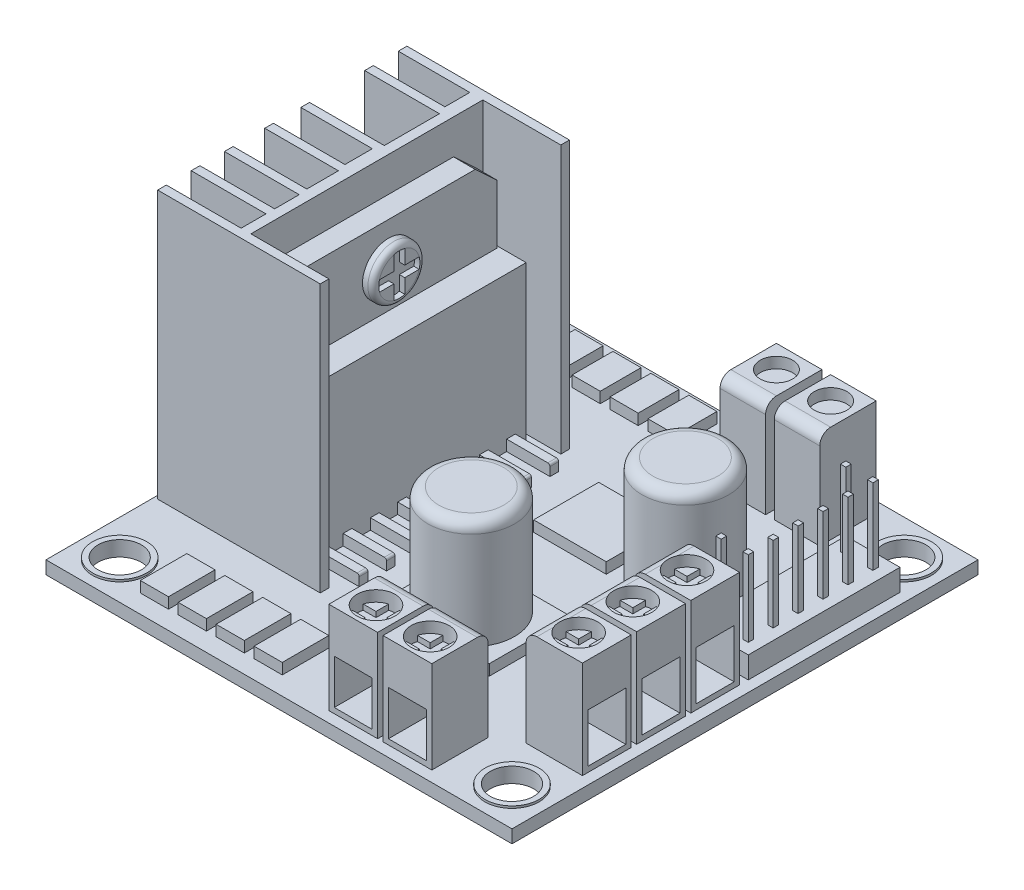
from build123d import *

# Parameters (mm, degrees)
CROQUIS2_W               = 43
CROQUIS2_H               = 43
SALIENTE_EXTRUIR1_DEPTH  = 1.2
CROQUIS3_W               = 15
CROQUIS3_H               = 23
SALIENTE_EXTRUIR2_DEPTH  = 24.7
CROQUIS4_W               = 6.4
CROQUIS4_H               = 21.4
CROQUIS4_W_2             = 0.8
CORTAR_EXTRUIR2_DEPTH    = 24.7
CROQUIS6_W               = 6.9
CROQUIS6_H               = 2.29421504
CROQUIS6_H_2             = 2.267309512
CROQUIS6_W_2             = 6.8
CROQUIS6_H_3             = 2.917748243
CROQUIS6_W_3             = 6.6
CROQUIS6_H_4             = 2.531488686
CROQUIS6_H_5             = 5.090458255
CROQUIS6_H_6             = 2.298780264
CORTAR_EXTRUIR4_DEPTH    = 24.7
SALIENTE_EXTRUIR3_DEPTH  = 2
CROQUIS8_R               = 2.4
SALIENTE_EXTRUIR4_DEPTH  = 1
REDONDEO1_R              = 0.5
CORTAR_EXTRUIR5_DEPTH    = 0.5
CROQUIS10_W              = 20.4
CROQUIS10_H              = 14.2
SALIENTE_EXTRUIR5_DEPTH  = 4.5
CROQUIS11_W              = 0.8
CROQUIS11_H              = 1
SALIENTE_EXTRUIR6_DEPTH  = 4
REDONDEO3_R              = 0.2
SALIENTE_EXTRUIR8_DEPTH  = 1
CROQUIS14_R              = 4
SALIENTE_EXTRUIR9_DEPTH  = 10
REDONDEO4_R              = 1
CROQUIS15_R              = 2.5
CROQUIS15_R_2            = 2
SALIENTE_EXTRUIR10_DEPTH = 0.2
CROQUIS16_R              = 2
CORTAR_EXTRUIR6_DEPTH    = 66.636041928
CROQUIS17_W              = 6.7
CROQUIS17_H              = 6
SALIENTE_EXTRUIR11_DEPTH = 1
CROQUIS18_W              = 2.6
CROQUIS18_H              = 4.3
SALIENTE_EXTRUIR12_DEPTH = 1
CROQUIS19_W              = 4.5
CROQUIS19_H              = 5.2
SALIENTE_EXTRUIR13_DEPTH = 8.5
REDONDEO5_R              = 1
CROQUIS20_W              = 3.5
CROQUIS20_H              = 4.1
CORTAR_EXTRUIR7_DEPTH    = 4.2
CROQUIS21_R              = 1.75
CORTAR_EXTRUIR8_DEPTH    = 1
CORTAR_EXTRUIR9_DEPTH    = 0.5
CROQUIS23_R              = 4
SALIENTE_EXTRUIR14_DEPTH = 10
REDONDEO6_R              = 1
CROQUIS24_W              = 5.2
CROQUIS24_H              = 4.5
SALIENTE_EXTRUIR15_DEPTH = 9
CROQUIS25_W              = 3.5
CROQUIS25_H              = 4.5
CORTAR_EXTRUIR10_DEPTH   = 4.2
CROQUIS26_R              = 1.75
CORTAR_EXTRUIR11_DEPTH   = 1
CORTAR_EXTRUIR12_DEPTH   = 0.5
CROQUIS28_W              = 5
CROQUIS28_H              = 14
SALIENTE_EXTRUIR16_DEPTH = 2
CROQUIS29_W              = 0.5
CROQUIS29_H              = 0.5
SALIENTE_EXTRUIR17_DEPTH = 7
CROQUIS30_W              = 0.5
CROQUIS30_H              = 0.5
SALIENTE_EXTRUIR18_DEPTH = 7
CROQUIS31_W              = 4.2
CROQUIS31_H              = 5.2
SALIENTE_EXTRUIR19_DEPTH = 9
REDONDEO7_R              = 1
REDONDEO8_R              = 1
CROQUIS32_W              = 3.2
CROQUIS32_H              = 4.5
CORTAR_EXTRUIR13_DEPTH   = 4.2
CROQUIS33_R              = 1.5
CORTAR_EXTRUIR14_DEPTH   = 1
CROQUIS34_W              = 2.6
CROQUIS34_H              = 3.769088543
SALIENTE_EXTRUIR20_DEPTH = 1


with BuildPart() as part:
    # Croquis2 → Saliente-Extruir1 (new body)
    with BuildSketch(Plane(origin=(0, 0, 0), x_dir=(1, 0, 0), z_dir=(0, 1, 0))):
        with Locations((21.5, 21.5)):
            Rectangle(CROQUIS2_W, CROQUIS2_H)
    extrude(amount=SALIENTE_EXTRUIR1_DEPTH)

    # Croquis3 → Saliente-Extruir2 (add)
    with BuildSketch(Plane(origin=(0, 1.2, 0), x_dir=(1, 0, 0), z_dir=(0, 1, 0))):
        with Locations((7.804211514, 21.5)):
            Rectangle(CROQUIS3_W, CROQUIS3_H)
    extrude(amount=SALIENTE_EXTRUIR2_DEPTH)

    # Croquis4 → Cortar-Extruir2 (cut)
    with BuildSketch(Plane(origin=(0, 25.9, 0), x_dir=(1, 0, 0), z_dir=(0, 1, 0))):
        with Locations((11.304211514, 21.5)):
            Rectangle(CROQUIS4_W, CROQUIS4_H)
        with Locations((14.904211514, 21.5)):
            Rectangle(CROQUIS4_W_2, CROQUIS4_H)
    extrude(amount=-CORTAR_EXTRUIR2_DEPTH, mode=Mode.SUBTRACT)

    # Croquis6 → Cortar-Extruir4 (cut)
    with BuildSketch(Plane(origin=(0, 25.9, 0), x_dir=(1, 0, 0), z_dir=(0, 1, 0))):
        with Locations((3.754211514, 11.94710752)):
            Rectangle(CROQUIS6_W, CROQUIS6_H)
        with Locations((3.754211514, 15.027869796)):
            Rectangle(CROQUIS6_W, CROQUIS6_H_2)
        with Locations((3.704211514, 18.420398674)):
            Rectangle(CROQUIS6_W_2, CROQUIS6_H_3)
        with Locations((3.604211514, 21.945017138)):
            Rectangle(CROQUIS6_W_3, CROQUIS6_H_4)
        with Locations((3.754211514, 26.555990609)):
            Rectangle(CROQUIS6_W, CROQUIS6_H_5)
        with Locations((3.604211514, 31.050609868)):
            Rectangle(CROQUIS6_W_3, CROQUIS6_H_6)
    extrude(amount=-CORTAR_EXTRUIR4_DEPTH, mode=Mode.SUBTRACT)

    # Croquis7 → Saliente-Extruir3 (add)
    with BuildSketch(Plane(origin=(8.104211514, 0, 0), x_dir=(0, 0, -1), z_dir=(1, 0, 0))):
        Polygon((11.5, 15.4), (11.5, 20.540868499), (13.5, 22.7), (29.5, 22.7), (31.5, 20.847403251), (31.5, 15.4), align=None)
    extrude(amount=SALIENTE_EXTRUIR3_DEPTH)

    # Croquis8 → Saliente-Extruir4 (add)
    with BuildSketch(Plane(origin=(10.104211514, 0, 0), x_dir=(0, 0, -1), z_dir=(1, 0, 0))):
        with Locations(Location((21.5, 18.8, 0), (0, 0, 180))):
            Circle(CROQUIS8_R)
    extrude(amount=SALIENTE_EXTRUIR4_DEPTH)

    # Redondeo1
    redondeo1_edges = [part.edges().sort_by_distance(p)[0] for p in [
        (11.104211514, 18.8, -23.9),
    ]]
    fillet(redondeo1_edges, radius=REDONDEO1_R)

    # Croquis9 → Cortar-Extruir5 (cut)
    with BuildSketch(Plane(origin=(11.104211514, 0, 0), x_dir=(0, 0, -1), z_dir=(1, 0, 0))):
        with BuildLine():
            ThreePointArc((22.000317471, 20.632943651), (21.50032907, 20.699999972), (21.000317471, 20.633116846))
            Line((21.000317471, 20.633116846), (21.000317471, 19.3))
            Line((21.000317471, 19.3), (19.666969722, 19.3))
            ThreePointArc((19.666969722, 19.3), (19.6, 18.8), (19.666969722, 18.3))
            Line((19.666969722, 18.3), (21.000317471, 18.3))
            Line((21.000317471, 18.3), (21.000317471, 16.966883154))
            ThreePointArc((21.000317471, 16.966883154), (21.50032907, 16.900000028), (22.000317471, 16.967056349))
            Line((22.000317471, 16.967056349), (22.000317471, 18.3))
            Line((22.000317471, 18.3), (23.333030278, 18.3))
            ThreePointArc((23.333030278, 18.3), (23.383183147, 18.547767496), (23.4, 18.8))
            ThreePointArc((23.4, 18.8), (23.383183147, 19.052232504), (23.333030278, 19.3))
            Line((23.333030278, 19.3), (22.000317471, 19.3))
            Line((22.000317471, 19.3), (22.000317471, 20.632943651))
        make_face()
    extrude(amount=-CORTAR_EXTRUIR5_DEPTH, mode=Mode.SUBTRACT)

    # Croquis10 → Saliente-Extruir5 (add)
    with BuildSketch(Plane(origin=(8.104211514, 0, 0), x_dir=(0, 0, -1), z_dir=(1, 0, 0))):
        with Locations((21.5, 8.3)):
            Rectangle(CROQUIS10_W, CROQUIS10_H)
    extrude(amount=SALIENTE_EXTRUIR5_DEPTH)

    # Croquis11 → Saliente-Extruir6 (add)
    with BuildSketch(Plane(origin=(12.604211514, 0, 0), x_dir=(0, 0, -1), z_dir=(1, 0, 0))):
        with Locations((12.7, 1.7)):
            Rectangle(CROQUIS11_W, CROQUIS11_H)
        with Locations((15.214285714, 1.7)):
            Rectangle(CROQUIS11_W, CROQUIS11_H)
        with Locations((17.728571429, 1.7)):
            Rectangle(CROQUIS11_W, CROQUIS11_H)
        with Locations((20.242857143, 1.7)):
            Rectangle(CROQUIS11_W, CROQUIS11_H)
        with Locations((22.757142857, 1.7)):
            Rectangle(CROQUIS11_W, CROQUIS11_H)
        with Locations((25.271428571, 1.7)):
            Rectangle(CROQUIS11_W, CROQUIS11_H)
        with Locations((27.785714286, 1.7)):
            Rectangle(CROQUIS11_W, CROQUIS11_H)
        with Locations((30.3, 1.7)):
            Rectangle(CROQUIS11_W, CROQUIS11_H)
    extrude(amount=SALIENTE_EXTRUIR6_DEPTH)

    # Redondeo3
    redondeo3_edges = [part.edges().sort_by_distance(p)[0] for p in [
        (16.604211514, 2.2, -12.7),
        (16.604211514, 2.2, -15.214285714),
        (16.604211514, 2.2, -17.728571429),
        (16.604211514, 2.2, -20.242857143),
        (16.604211514, 2.2, -22.757142857),
        (16.604211514, 2.2, -25.271428571),
        (16.604211514, 2.2, -27.785714286),
        (16.604211514, 2.2, -30.3),
    ]]
    fillet(redondeo3_edges, radius=REDONDEO3_R)

    # Croquis13 → Saliente-Extruir8 (add)
    with BuildSketch(Plane(origin=(0, 1.2, 0), x_dir=(1, 0, 0), z_dir=(0, 1, 0))):
        Polygon((19.752429215, 18.69169285), (19.752429215, 11.19169285), (20.944122065, 10), (28.560736365, 10), (29.752429215, 11.19169285), (29.752429215, 18.69169285), align=None)
    extrude(amount=SALIENTE_EXTRUIR8_DEPTH)

    # Croquis14 → Saliente-Extruir9 (add)
    with BuildSketch(Plane(origin=(0, 2.2, 0), x_dir=(1, 0, 0), z_dir=(0, 1, 0))):
        with Locations(Location((24.752429215, 14.49169285, 0), (0, 0, 270))):
            Circle(CROQUIS14_R)
    extrude(amount=SALIENTE_EXTRUIR9_DEPTH)

    # Redondeo4
    redondeo4_edges = [part.edges().sort_by_distance(p)[0] for p in [
        (24.752429215, 12.2, -18.49169285),
    ]]
    fillet(redondeo4_edges, radius=REDONDEO4_R)

    # Croquis15 → Saliente-Extruir10 (add)
    # profile 1 of 4: a face of its own
    with BuildSketch(Plane(origin=(0, 1.2, 0), x_dir=(1, 0, 0), z_dir=(0, 1, 0))):
        with Locations(Location((39.6, 39.6, 0), (0, 0, 90))):
            Circle(CROQUIS15_R)
        with Locations(Location((39.6, 39.6, 0), (0, 0, 270))):
            Circle(CROQUIS15_R_2, mode=Mode.SUBTRACT)
    # profile 2 of 4: a face of its own
    with BuildSketch(Plane(origin=(0, 1.2, 0), x_dir=(1, 0, 0), z_dir=(0, 1, 0))):
        with Locations(Location((3.4, 39.6, 0), (0, 0, 90))):
            Circle(CROQUIS15_R)
        with Locations(Location((3.4, 39.6, 0), (0, 0, 270))):
            Circle(CROQUIS15_R_2, mode=Mode.SUBTRACT)
    # profile 3 of 4: a face of its own
    with BuildSketch(Plane(origin=(0, 1.2, 0), x_dir=(1, 0, 0), z_dir=(0, 1, 0))):
        with Locations(Location((39.6, 3.4, 0), (0, 0, 90))):
            Circle(CROQUIS15_R)
        with Locations(Location((39.6, 3.4, 0), (0, 0, 270))):
            Circle(CROQUIS15_R_2, mode=Mode.SUBTRACT)
    # profile 4 of 4: a face of its own
    with BuildSketch(Plane(origin=(0, 1.2, 0), x_dir=(1, 0, 0), z_dir=(0, 1, 0))):
        with Locations(Location((3.4, 3.4, 0), (0, 0, 90))):
            Circle(CROQUIS15_R)
        with Locations(Location((3.4, 3.4, 0), (0, 0, 270))):
            Circle(CROQUIS15_R_2, mode=Mode.SUBTRACT)
    extrude(amount=SALIENTE_EXTRUIR10_DEPTH)

    # Croquis16 → Cortar-Extruir6 (cut, through all)
    with BuildSketch(Plane(origin=(0, 1.2, 0), x_dir=(1, 0, 0), z_dir=(0, 1, 0))):
        with Locations(Location((3.4, 39.6, 0), (0, 0, 270))):
            Circle(CROQUIS16_R)
        with Locations(Location((39.6, 3.4, 0), (0, 0, 270))):
            Circle(CROQUIS16_R)
        with Locations(Location((3.4, 3.4, 0), (0, 0, 270))):
            Circle(CROQUIS16_R)
        with Locations(Location((39.6, 39.6, 0), (0, 0, 270))):
            Circle(CROQUIS16_R)
    extrude(amount=-CORTAR_EXTRUIR6_DEPTH, mode=Mode.SUBTRACT)

    # Croquis17 → Saliente-Extruir11 (add)
    with BuildSketch(Plane(origin=(0, 1.2, 0), x_dir=(1, 0, 0), z_dir=(0, 1, 0))):
        with Locations((23.654211514, 27.69169285)):
            Rectangle(CROQUIS17_W, CROQUIS17_H)
    extrude(amount=SALIENTE_EXTRUIR11_DEPTH)

    # Croquis18 → Saliente-Extruir12 (add)
    with BuildSketch(Plane(origin=(0, 1.2, 0), x_dir=(1, 0, 0), z_dir=(0, 1, 0))):
        with Locations((8.3, 3.85)):
            Rectangle(CROQUIS18_W, CROQUIS18_H)
        with Locations((11.8, 3.85)):
            Rectangle(CROQUIS18_W, CROQUIS18_H)
        with Locations((15.3, 3.85)):
            Rectangle(CROQUIS18_W, CROQUIS18_H)
        with Locations((18.8, 3.85)):
            Rectangle(CROQUIS18_W, CROQUIS18_H)
    extrude(amount=SALIENTE_EXTRUIR12_DEPTH)

    # Croquis19 → Saliente-Extruir13 (add)
    with BuildSketch(Plane(origin=(0, 1.2, 0), x_dir=(1, 0, 0), z_dir=(0, 1, 0))):
        with Locations((27.35, 3.6)):
            Rectangle(CROQUIS19_W, CROQUIS19_H)
        with Locations((32.35, 3.6)):
            Rectangle(CROQUIS19_W, CROQUIS19_H)
    extrude(amount=SALIENTE_EXTRUIR13_DEPTH)

    # Redondeo5
    redondeo5_edges = [part.edges().sort_by_distance(p)[0] for p in [
        (27.35, 9.7, -6.2),
        (32.35, 9.7, -6.2),
    ]]
    fillet(redondeo5_edges, radius=REDONDEO5_R)

    # Croquis20 → Cortar-Extruir7 (cut)
    with BuildSketch(Plane.XY.offset(-1)):
        with Locations((27.35, 3.75)):
            Rectangle(CROQUIS20_W, CROQUIS20_H)
        with Locations((32.35, 3.75)):
            Rectangle(CROQUIS20_W, CROQUIS20_H)
    extrude(amount=-CORTAR_EXTRUIR7_DEPTH, mode=Mode.SUBTRACT)

    # Croquis21 → Cortar-Extruir8 (cut)
    with BuildSketch(Plane(origin=(0, 9.7, 0), x_dir=(1, 0, 0), z_dir=(0, 1, 0))):
        with Locations(Location((27.35, 3.1, 0), (0, 0, 270))):
            Circle(CROQUIS21_R)
        with Locations(Location((32.35, 3.1, 0), (0, 0, 270))):
            Circle(CROQUIS21_R)
    extrude(amount=-CORTAR_EXTRUIR8_DEPTH, mode=Mode.SUBTRACT)

    # Croquis22 → Cortar-Extruir9 (cut)
    with BuildSketch(Plane(origin=(0, 8.7, 0), x_dir=(1, 0, 0), z_dir=(0, 1, 0))):
        with BuildLine():
            ThreePointArc((27.85, 4.777050983), (27.35, 4.85), (26.85, 4.777050983))
            Line((26.85, 4.777050983), (26.85, 3.6))
            Line((26.85, 3.6), (25.672949017, 3.6))
            ThreePointArc((25.672949017, 3.6), (25.6, 3.1), (25.672949017, 2.6))
            Line((25.672949017, 2.6), (26.85, 2.6))
            Line((26.85, 2.6), (26.85, 1.422949017))
            ThreePointArc((26.85, 1.422949017), (27.35, 1.35), (27.85, 1.422949017))
            Line((27.85, 1.422949017), (27.85, 2.6))
            Line((27.85, 2.6), (29.027050983, 2.6))
            ThreePointArc((29.027050983, 2.6), (29.081666715, 2.847353231), (29.1, 3.1))
            ThreePointArc((29.1, 3.1), (29.081666715, 3.352646769), (29.027050983, 3.6))
            Line((29.027050983, 3.6), (27.85, 3.6))
            Line((27.85, 3.6), (27.85, 4.777050983))
        make_face()
        with BuildLine():
            ThreePointArc((30.672949017, 3.6), (30.6, 3.1), (30.672949017, 2.6))
            Line((30.672949017, 2.6), (31.85, 2.6))
            Line((31.85, 2.6), (31.85, 1.422949017))
            ThreePointArc((31.85, 1.422949017), (32.35, 1.35), (32.85, 1.422949017))
            Line((32.85, 1.422949017), (32.85, 2.6))
            Line((32.85, 2.6), (34.027050983, 2.6))
            ThreePointArc((34.027050983, 2.6), (34.081666715, 2.847353231), (34.1, 3.1))
            ThreePointArc((34.1, 3.1), (34.081666715, 3.352646769), (34.027050983, 3.6))
            Line((34.027050983, 3.6), (32.85, 3.6))
            Line((32.85, 3.6), (32.85, 4.777050983))
            ThreePointArc((32.85, 4.777050983), (32.35, 4.85), (31.85, 4.777050983))
            Line((31.85, 4.777050983), (31.85, 3.6))
            Line((31.85, 3.6), (30.672949017, 3.6))
        make_face()
    extrude(amount=-CORTAR_EXTRUIR9_DEPTH, mode=Mode.SUBTRACT)

    # Croquis23 → Saliente-Extruir14 (add)
    with BuildSketch(Plane(origin=(0, 1.2, 0), x_dir=(1, 0, 0), z_dir=(0, 1, 0))):
        with Locations(Location((31.311595573, 27.69169285, 0), (0, 0, 90))):
            Circle(CROQUIS23_R)
    extrude(amount=SALIENTE_EXTRUIR14_DEPTH)

    # Redondeo6
    redondeo6_edges = [part.edges().sort_by_distance(p)[0] for p in [
        (31.311595573, 11.2, -23.69169285),
    ]]
    fillet(redondeo6_edges, radius=REDONDEO6_R)

    # Croquis24 → Saliente-Extruir15 (add)
    with BuildSketch(Plane(origin=(0, 1.2, 0), x_dir=(1, 0, 0), z_dir=(0, 1, 0))):
        with Locations((39.4, 9.75)):
            Rectangle(CROQUIS24_W, CROQUIS24_H)
        with Locations((39.4, 14.75)):
            Rectangle(CROQUIS24_W, CROQUIS24_H)
        with Locations((39.4, 19.75)):
            Rectangle(CROQUIS24_W, CROQUIS24_H)
    extrude(amount=SALIENTE_EXTRUIR15_DEPTH)

    # Croquis25 → Cortar-Extruir10 (cut)
    with BuildSketch(Plane(origin=(42, 0, 0), x_dir=(0, 0, -1), z_dir=(1, 0, 0))):
        with Locations((9.75, 3.95)):
            Rectangle(CROQUIS25_W, CROQUIS25_H)
        with Locations((14.75, 3.95)):
            Rectangle(CROQUIS25_W, CROQUIS25_H)
        with Locations((19.75, 3.95)):
            Rectangle(CROQUIS25_W, CROQUIS25_H)
    extrude(amount=-CORTAR_EXTRUIR10_DEPTH, mode=Mode.SUBTRACT)

    # Croquis26 → Cortar-Extruir11 (cut)
    with BuildSketch(Plane(origin=(0, 10.2, 0), x_dir=(1, 0, 0), z_dir=(0, 1, 0))):
        with Locations(Location((39.4, 9.75, 0), (0, 0, 270))):
            Circle(CROQUIS26_R)
        with Locations(Location((39.4, 14.75, 0), (0, 0, 270))):
            Circle(CROQUIS26_R)
        with Locations(Location((39.4, 19.75, 0), (0, 0, 270))):
            Circle(CROQUIS26_R)
    extrude(amount=-CORTAR_EXTRUIR11_DEPTH, mode=Mode.SUBTRACT)

    # Croquis27 → Cortar-Extruir12 (cut)
    with BuildSketch(Plane(origin=(0, 9.2, 0), x_dir=(1, 0, 0), z_dir=(0, 1, 0))):
        with BuildLine():
            ThreePointArc((39.9, 21.427050983), (39.4, 21.5), (38.9, 21.427050983))
            Line((38.9, 21.427050983), (38.9, 20.25))
            Line((38.9, 20.25), (37.722949017, 20.25))
            ThreePointArc((37.722949017, 20.25), (37.65, 19.75), (37.722949017, 19.25))
            Line((37.722949017, 19.25), (38.9, 19.25))
            Line((38.9, 19.25), (38.9, 18.072949017))
            ThreePointArc((38.9, 18.072949017), (39.4, 18), (39.9, 18.072949017))
            Line((39.9, 18.072949017), (39.9, 19.25))
            Line((39.9, 19.25), (41.077050983, 19.25))
            ThreePointArc((41.077050983, 19.25), (41.131666715, 19.497353231), (41.15, 19.75))
            ThreePointArc((41.15, 19.75), (41.131666715, 20.002646769), (41.077050983, 20.25))
            Line((41.077050983, 20.25), (39.9, 20.25))
            Line((39.9, 20.25), (39.9, 21.427050983))
        make_face()
        with BuildLine():
            ThreePointArc((39.9, 16.427050983), (39.4, 16.5), (38.9, 16.427050983))
            Line((38.9, 16.427050983), (38.9, 15.25))
            Line((38.9, 15.25), (37.722949017, 15.25))
            ThreePointArc((37.722949017, 15.25), (37.65, 14.75), (37.722949017, 14.25))
            Line((37.722949017, 14.25), (38.9, 14.25))
            Line((38.9, 14.25), (38.9, 13.072949017))
            ThreePointArc((38.9, 13.072949017), (39.4, 13), (39.9, 13.072949017))
            Line((39.9, 13.072949017), (39.9, 14.25))
            Line((39.9, 14.25), (41.077050983, 14.25))
            ThreePointArc((41.077050983, 14.25), (41.131666715, 14.497353231), (41.15, 14.75))
            ThreePointArc((41.15, 14.75), (41.131666715, 15.002646769), (41.077050983, 15.25))
            Line((41.077050983, 15.25), (39.9, 15.25))
            Line((39.9, 15.25), (39.9, 16.427050983))
        make_face()
        with BuildLine():
            ThreePointArc((39.9, 11.427050983), (39.4, 11.5), (38.9, 11.427050983))
            Line((38.9, 11.427050983), (38.9, 10.25))
            Line((38.9, 10.25), (37.722949017, 10.25))
            ThreePointArc((37.722949017, 10.25), (37.65, 9.75), (37.722949017, 9.25))
            Line((37.722949017, 9.25), (38.9, 9.25))
            Line((38.9, 9.25), (38.9, 8.072949017))
            ThreePointArc((38.9, 8.072949017), (39.4, 8), (39.9, 8.072949017))
            Line((39.9, 8.072949017), (39.9, 9.25))
            Line((39.9, 9.25), (41.077050983, 9.25))
            ThreePointArc((41.077050983, 9.25), (41.131666715, 9.497353231), (41.15, 9.75))
            ThreePointArc((41.15, 9.75), (41.131666715, 10.002646769), (41.077050983, 10.25))
            Line((41.077050983, 10.25), (39.9, 10.25))
            Line((39.9, 10.25), (39.9, 11.427050983))
        make_face()
    extrude(amount=-CORTAR_EXTRUIR12_DEPTH, mode=Mode.SUBTRACT)

    # Croquis28 → Saliente-Extruir16 (add)
    with BuildSketch(Plane(origin=(0, 1.2, 0), x_dir=(1, 0, 0), z_dir=(0, 1, 0))):
        with Locations((39.5, 29.8)):
            Rectangle(CROQUIS28_W, CROQUIS28_H)
    extrude(amount=SALIENTE_EXTRUIR16_DEPTH)

    # Croquis29 → Saliente-Extruir17 (add)
    with BuildSketch(Plane(origin=(0, 3.2, 0), x_dir=(1, 0, 0), z_dir=(0, 1, 0))):
        with Locations((40.75, 24.05)):
            Rectangle(CROQUIS29_W, CROQUIS29_H)
        with Locations((40.75, 26.35)):
            Rectangle(CROQUIS29_W, CROQUIS29_H)
        with Locations((40.75, 28.65)):
            Rectangle(CROQUIS29_W, CROQUIS29_H)
        with Locations((40.75, 30.95)):
            Rectangle(CROQUIS29_W, CROQUIS29_H)
        with Locations((40.75, 33.25)):
            Rectangle(CROQUIS29_W, CROQUIS29_H)
        with Locations((40.75, 35.55)):
            Rectangle(CROQUIS29_W, CROQUIS29_H)
    extrude(amount=SALIENTE_EXTRUIR17_DEPTH)

    # Croquis30 → Saliente-Extruir18 (add)
    with BuildSketch(Plane(origin=(0, 3.2, 0), x_dir=(1, 0, 0), z_dir=(0, 1, 0))):
        with Locations((38.25, 35.55)):
            Rectangle(CROQUIS30_W, CROQUIS30_H)
        with Locations((38.254274942, 24.05)):
            Rectangle(CROQUIS30_W, CROQUIS30_H)
    extrude(amount=SALIENTE_EXTRUIR18_DEPTH)

    # Croquis31 → Saliente-Extruir19 (add)
    with BuildSketch(Plane(origin=(0, 1.2, 0), x_dir=(1, 0, 0), z_dir=(0, 1, 0))):
        with Locations((32.5, 39.4)):
            Rectangle(CROQUIS31_W, CROQUIS31_H)
        with Locations((27.5, 39.4)):
            Rectangle(CROQUIS31_W, CROQUIS31_H)
    extrude(amount=SALIENTE_EXTRUIR19_DEPTH)

    # Redondeo7
    redondeo7_edges = [part.edges().sort_by_distance(p)[0] for p in [
        (32.5, 10.2, -36.8),
        (27.5, 10.2, -36.8),
    ]]
    fillet(redondeo7_edges, radius=REDONDEO7_R)

    # Redondeo8
    # the kernel refuses this fillet: 1 mm, written as the material it takes off along each edge
    with BuildSketch(Plane(origin=(36.8, 10.2, -5), x_dir=(0, -1, 0), z_dir=(0, 0, -1))) as redondeo8_piece_1:
        with BuildLine():
            CenterArc((REDONDEO8_R, -REDONDEO8_R), REDONDEO8_R, 90, 90)
            Line((0, -REDONDEO8_R), (0, 0))
            Line((0, 0), (REDONDEO8_R, 0))
        make_face()
    extrude(amount=9.5, mode=Mode.SUBTRACT)
    with BuildSketch(Plane(origin=(36.8, 10.2, -19.5), x_dir=(0, -1, 0), z_dir=(0, 0, 1)), Plane(origin=(36.8, 10.2, -24.5), x_dir=(0, -1, 0), z_dir=(0, 0, 1))) as redondeo8_piece_2:
        with BuildLine():
            CenterArc((REDONDEO8_R, REDONDEO8_R), REDONDEO8_R, 180, 90)
            Line((0, REDONDEO8_R), (0, 0))
            Line((0, 0), (REDONDEO8_R, 0))
        make_face()
    extrude(amount=9.5, mode=Mode.SUBTRACT)

    # Croquis32 → Cortar-Extruir13 (cut)
    with BuildSketch(Plane(origin=(0, 0, -42), x_dir=(-1, 0, 0), z_dir=(0, 0, -1))):
        with Locations((-32.5, 3.95)):
            Rectangle(CROQUIS32_W, CROQUIS32_H)
        with Locations((-27.5, 3.95)):
            Rectangle(CROQUIS32_W, CROQUIS32_H)
    extrude(amount=-CORTAR_EXTRUIR13_DEPTH, mode=Mode.SUBTRACT)

    # Croquis33 → Cortar-Extruir14 (cut)
    with BuildSketch(Plane(origin=(0, 10.2, 0), x_dir=(1, 0, 0), z_dir=(0, 1, 0))):
        with Locations(Location((32.5, 39.9, 0), (0, 0, 270))):
            Circle(CROQUIS33_R)
        with Locations(Location((27.5, 39.9, 0), (0, 0, 270))):
            Circle(CROQUIS33_R)
    extrude(amount=-CORTAR_EXTRUIR14_DEPTH, mode=Mode.SUBTRACT)

    # Croquis34 → Saliente-Extruir20 (add)
    with BuildSketch(Plane(origin=(0, 1.2, 0), x_dir=(1, 0, 0), z_dir=(0, 1, 0))):
        with Locations((8.3, 39.926655102)):
            Rectangle(CROQUIS34_W, CROQUIS34_H)
        with Locations((11.8, 39.926655102)):
            Rectangle(CROQUIS34_W, CROQUIS34_H)
        with Locations((15.3, 39.926655102)):
            Rectangle(CROQUIS34_W, CROQUIS34_H)
        with Locations((18.8, 39.926655102)):
            Rectangle(CROQUIS34_W, CROQUIS34_H)
    extrude(amount=SALIENTE_EXTRUIR20_DEPTH)


solid = part.part
